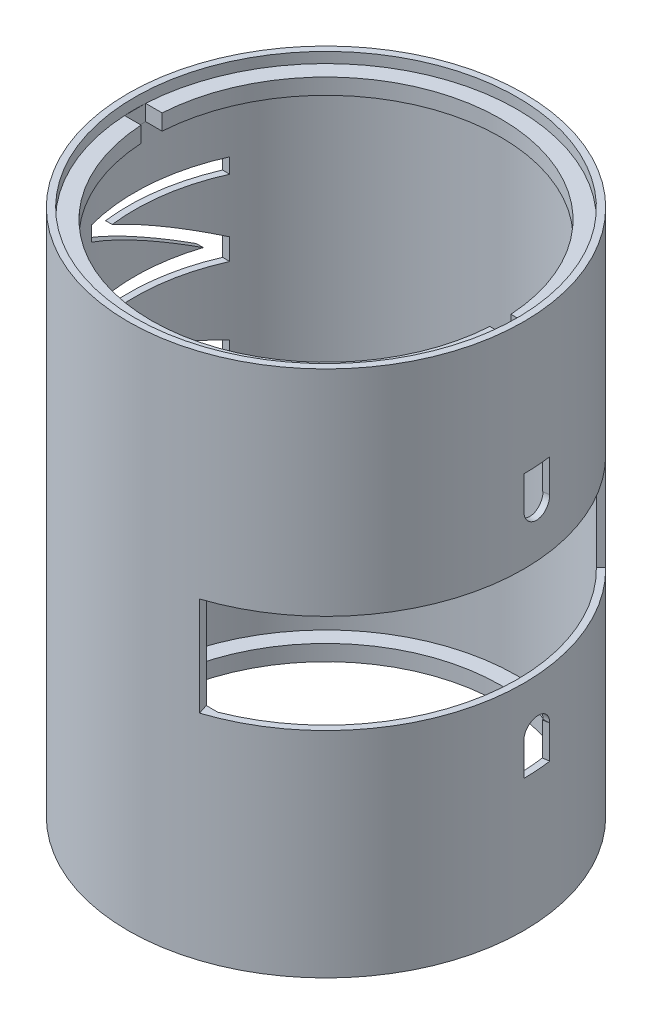
from build123d import *

# Parameters (mm, degrees)
EXTRUDE_11_REACH             = 60.31
EXTRUDE_11_DIRECTION_2_REACH = 60.31
CUT_EXTRUDE_1_DEPTH          = 7.5
CUT_EXTRUDE_1_DEPTH_BACK     = 7.5
CUT_EXTRUDE_2_DEPTH          = 5
CUT_EXTRUDE_START            = 28.688718626
CUT_EXTRUDE_3_DEPTH          = 1.311276176
CUT_EXTRUDE_4_DEPTH          = 50
CUT_EXTRUDE_4_DEPTH_BACK     = 50
SKETCH_14_W                  = 57.911656858
SKETCH_14_H                  = 3.2
SCALE_1_SCALE                = 0.95
SKETCH_15_R                  = 3
CUT_EXTRUDE_5_DEPTH          = 56.394043173
CUT_EXTRUDE_8_DEPTH          = 56.394043173


# Read off the part's stored shape, not the designer's step: 切除-拉伸3
with BuildPart() as part:
    # 草图1 → 旋转1 (revolve)
    with BuildSketch(Plane.XY, mode=Mode.PRIVATE) as revolve_1_sk:
        Polygon((26.5, 38.4), (26.5, 36), (29, 36), (29, 0), (30, 0), (30, 40), (29, 40), (29, 38.4), align=None)
    revolve_1 = revolve(revolve_1_sk.sketch.rotate(Axis((0, 66, 0), (0, -1, 0)), 90), axis=Axis((0, 66, 0), (0, -1, 0)))

    # 镜向1: 旋转1 across plane
    add(revolve_1.mirror(Plane.ZX))

    # 凸台-拉伸11: up to this face of the body (flat: up to its plane)
    extrude_11_end = Plane(part.part.faces().sort_by_distance((0, 36, -27.320243866))[0])
    # 草图11 → 凸台-拉伸11 (add, up to the picked face)
    with BuildSketch(Plane(origin=(0, 0, 0), x_dir=(1, 0, 0), z_dir=(0, 1, 0)), mode=Mode.PRIVATE) as extrude_11_sk1:
        with BuildLine():
            Line((-13.076696831, -27), (13.076696831, -27))
            ThreePointArc((13.076696831, -27), (0, -30), (-13.076696831, -27))
        make_face()
    extrude_11_tool1 = split(extrude(extrude_11_sk1.sketch, amount=EXTRUDE_11_REACH, mode=Mode.PRIVATE), bisect_by=extrude_11_end, keep=Keep.BOTH, mode=Mode.PRIVATE)
    add(extrude_11_tool1.solids().sort_by(Axis((0, 0, 28.205296), (0, 1, 0)))[0])

    # 凸台-拉伸11 direction 2: up to this face of the body (flat: up to its plane)
    extrude_11_direction_2_end = Plane(part.part.faces().sort_by_distance((0, -36, -27.320243866))[0])
    # 草图11 → 凸台-拉伸11 direction 2 (add, up to the picked face)
    with BuildSketch(Plane(origin=(0, 0, 0), x_dir=(1, 0, 0), z_dir=(0, 1, 0)), mode=Mode.PRIVATE) as extrude_11_direction_2_sk1:
        with BuildLine():
            Line((-13.076696831, -27), (13.076696831, -27))
            ThreePointArc((13.076696831, -27), (0, -30), (-13.076696831, -27))
        make_face()
    extrude_11_direction_2_tool1 = split(extrude(extrude_11_direction_2_sk1.sketch, amount=-EXTRUDE_11_DIRECTION_2_REACH, mode=Mode.PRIVATE), bisect_by=extrude_11_direction_2_end, keep=Keep.BOTH, mode=Mode.PRIVATE)
    add(extrude_11_direction_2_tool1.solids().sort_by(Axis((0, 0, 28.205296), (0, -1, 0)))[0])

    # 草图12 → 切除-拉伸1 (cut, two sides: drawn at the far end of the back side and taken through both)
    with BuildSketch(Plane(origin=(0, 0, 0), x_dir=(1, 0, 0), z_dir=(0, 1, 0)).offset(-CUT_EXTRUDE_1_DEPTH_BACK)):
        with BuildLine():
            Line((0, 0), (22.520337054, 22.934948885))
            ThreePointArc((22.520337054, 22.934948885), (31.296937417, -7.32660697), (10, -30.547953473))
            Line((10, -30.547953473), (0, 0))
        make_face()
    extrude(amount=CUT_EXTRUDE_1_DEPTH + CUT_EXTRUDE_1_DEPTH_BACK, mode=Mode.SUBTRACT)

    # Sketch 3D_2 → 切除-拉伸2 (cut)
    with BuildSketch(Plane(origin=(35, 15, -4.993961669), x_dir=(-0.989973390659655, 0, 0.1412539761770484), z_dir=(0, 1, 0))):
        with BuildLine():
            Line((0, 0), (35.354485616, 0))
            Line((35.354485616, 0), (0.330334968, 4.976372773))
            ThreePointArc((0.330334968, 4.976372773), (0.075684949, 2.494126297), (0, 0))
        make_face()
    cut_extrude_2 = extrude(amount=CUT_EXTRUDE_2_DEPTH, mode=Mode.SUBTRACT)

    # 镜向2: 切除-拉伸2 across plane
    add(cut_extrude_2.mirror(Plane.ZX), mode=Mode.SUBTRACT)

    # 切除-拉伸3 outline → 切除-拉伸3 (cut)
    with BuildSketch(Plane.YZ.offset(CUT_EXTRUDE_START)):
        with BuildLine():
            Line((15, -4.237619285), (15, -0.017659399))
            add(Edge.make_bspline(
                [(15, -0.017659399), (12.884666816, -0.017659399), (12.884666816, -2.127639342), (12.884666816, -4.237619285), (15, -4.237619285)],
                knots=[3.141592654, 3.141592654, 3.141592654, 4.71238898, 4.71238898, 6.283185307, 6.283185307, 6.283185307], degree=2, weights=[1, 0.707106781, 1, 0.707106781, 1]))
        make_face()
    cut_extrude_3 = extrude(amount=CUT_EXTRUDE_3_DEPTH, mode=Mode.SUBTRACT)

    # 镜向3: 切除-拉伸3 across plane
    add(cut_extrude_3.mirror(Plane.ZX), mode=Mode.SUBTRACT)

    # 草图14 → 切除-拉伸4 (cut, two sides: drawn at the far end of the back side and taken through both)
    with BuildSketch(Plane(origin=(0, 0, 0), x_dir=(1, 0, 0), z_dir=(0, 1, 0)).offset(-CUT_EXTRUDE_4_DEPTH_BACK)):
        Rectangle(SKETCH_14_W, SKETCH_14_H)
    extrude(amount=CUT_EXTRUDE_4_DEPTH + CUT_EXTRUDE_4_DEPTH_BACK, mode=Mode.SUBTRACT)


with BuildPart() as part_1:
    # 缩放比例1: scaled about (0, 0, 0)
    add(part.part.scale(SCALE_1_SCALE))

    # 草图15 → 切除-拉伸5 (cut, through all)
    with BuildSketch(Plane.XY):
        Circle(SKETCH_15_R)
    extrude(amount=-CUT_EXTRUDE_5_DEPTH, mode=Mode.SUBTRACT)

    # 草图17 → 切除-拉伸8 (cut, through all)
    with BuildSketch(Plane(origin=(0, 0, 0), x_dir=(0, 0, -1), z_dir=(1, 0, 0))):
        Polygon((-7.160216771, -7.13563981), (-7.160216771, -3.80592806), (8.522673115, 1.128292258), (-7.160216771, 5.828299564), (-7.160216771, 8.761718002), (11.264359726, 3.240054279), (11.264359726, -1.338817901), align=None)
        Polygon((-7.160216771, 13.060987956), (-7.160216771, 15.637647282), (8.522673115, 15.637647282), (-7.160216771, 23.954695298), (-7.160216771, 26.120129901), (11.264359726, 26.120129901), (11.264359726, 23.954695298), (-3.480090007, 23.954695298), (11.264359726, 16.13532672), (11.264359726, 13.060987956), align=None)
        Polygon((11.264359726, -11.172137384), (11.264359726, -24.820978501), (8.522673115, -24.820978501), (8.522673115, -15.337987323), (-7.160216771, -24.820978501), (-7.160216771, -11.172137384), (-4.532843234, -11.172137384), (-4.532843234, -20.724250381), align=None)
    extrude(amount=-CUT_EXTRUDE_8_DEPTH, mode=Mode.SUBTRACT)


solid = part_1.part
